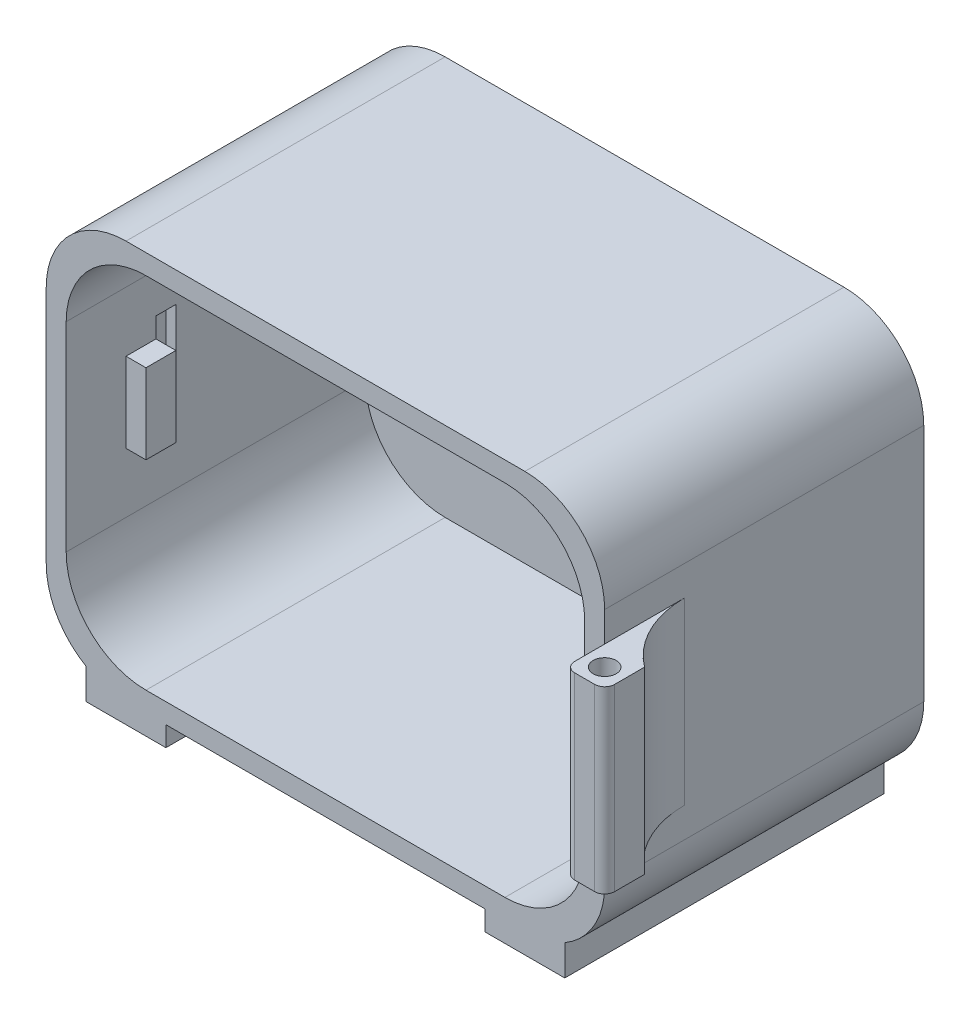
from build123d import *

# Parameters (mm, degrees)
BOSS_EXTRUDE1_DEPTH             = 95.25
BOSS_EXTRUDE2_DEPTH             = 6.35
SKETCH4_W                       = 25.4
SKETCH4_H                       = 101.6
BOSS_EXTRUDE3_DEPTH             = 6.35
BOSS_EXTRUDE3_DIRECTION_2_REACH = 187.35
BOSS_EXTRUDE5_DEPTH             = 28.575
BOSS_EXTRUDE5_DEPTH_BACK        = 28.575
SKETCH5_R                       = 3.675
FILLET1_R                       = 3.175
SKETCH8_W                       = 6.35
SKETCH8_H                       = 38.1
CUT_EXTRUDE1_DEPTH              = 3.175
SKETCH10_W                      = 9.525
SKETCH10_H                      = 25.4
BOSS_EXTRUDE6_DEPTH             = 6.35
SKETCH11_R                      = 44.824096384
CUT_EXTRUDE4_DEPTH              = 1.5875
SKETCH12_W                      = 1.13974359
SKETCH12_H                      = 13.025641026
SKETCH12_W_2                    = 4.884615385
SKETCH12_H_2                    = 1.302564103
CUT_EXTRUDE5_DEPTH              = 1.5875
FILLET2_R                       = 3.175


with BuildPart() as part:
    # Sketch1 → Boss-Extrude1 (new body)
    with BuildSketch(Plane.XY):
        with BuildLine():
            Line((-63.5, 63.5), (63.5, 63.5))
            ThreePointArc((63.5, 63.5), (81.460512242, 56.060512242), (88.9, 38.1))
            Line((88.9, 38.1), (88.9, -38.1))
            ThreePointArc((88.9, -38.1), (81.460512242, -56.060512242), (63.5, -63.5))
            Line((63.5, -63.5), (-63.5, -63.5))
            ThreePointArc((-63.5, -63.5), (-81.460512242, -56.060512242), (-88.9, -38.1))
            Line((-88.9, -38.1), (-88.9, 38.1))
            ThreePointArc((-88.9, 38.1), (-81.460512242, 56.060512242), (-63.5, 63.5))
        make_face()
        with BuildLine():
            Line((-82.55, 31.75), (-82.55, -31.75))
            ThreePointArc((-82.55, -31.75), (-75.110512242, -49.710512242), (-57.15, -57.15))
            Line((-57.15, -57.15), (57.15, -57.15))
            ThreePointArc((57.15, -57.15), (75.110512242, -49.710512242), (82.55, -31.75))
            Line((82.55, -31.75), (82.55, 31.75))
            ThreePointArc((82.55, 31.75), (75.110512242, 49.710512242), (57.15, 57.15))
            Line((57.15, 57.15), (-57.15, 57.15))
            ThreePointArc((-57.15, 57.15), (-75.110512242, 49.710512242), (-82.55, 31.75))
        make_face(mode=Mode.SUBTRACT)
    extrude(amount=-BOSS_EXTRUDE1_DEPTH)

    # Sketch2 → Boss-Extrude2 (add)
    with BuildSketch(Plane(origin=(0, 0, -95.25), x_dir=(-1, 0, 0), z_dir=(0, 0, -1))):
        with BuildLine():
            Line((-63.5, 63.5), (63.5, 63.5))
            ThreePointArc((63.5, 63.5), (81.460512242, 56.060512242), (88.9, 38.1))
            Line((88.9, 38.1), (88.9, -38.1))
            ThreePointArc((88.9, -38.1), (81.460512242, -56.060512242), (63.5, -63.5))
            Line((63.5, -63.5), (-63.5, -63.5))
            ThreePointArc((-63.5, -63.5), (-81.460512242, -56.060512242), (-88.9, -38.1))
            Line((-88.9, -38.1), (-88.9, 38.1))
            ThreePointArc((-88.9, 38.1), (-81.460512242, 56.060512242), (-63.5, 63.5))
        make_face()
    extrude(amount=BOSS_EXTRUDE2_DEPTH)

    # Sketch4 → Boss-Extrude3 (add)
    with BuildSketch(Plane.XZ.offset(63.5)):
        with Locations((-63.5, -50.8)):
            Rectangle(SKETCH4_W, SKETCH4_H)
        with Locations((63.5, -50.8)):
            Rectangle(SKETCH4_W, SKETCH4_H)
    extrude(amount=BOSS_EXTRUDE3_DEPTH)

    # Sketch4 → Boss-Extrude3 direction 2 (add, up to next)
    with BuildSketch(Plane.XZ.offset(63.5), mode=Mode.PRIVATE) as boss_extrude3_direction_2_sk1:
        with Locations((-63.5, -50.8)):
            Rectangle(SKETCH4_W, SKETCH4_H)
    boss_extrude3_direction_2_tool1 = extrude(boss_extrude3_direction_2_sk1.sketch, amount=-BOSS_EXTRUDE3_DIRECTION_2_REACH, mode=Mode.PRIVATE) - part.part
    # Sketch4 → Boss-Extrude3 direction 2 (add, up to next)
    with BuildSketch(Plane.XZ.offset(63.5), mode=Mode.PRIVATE) as boss_extrude3_direction_2_sk2:
        with Locations((63.5, -50.8)):
            Rectangle(SKETCH4_W, SKETCH4_H)
    boss_extrude3_direction_2_tool2 = extrude(boss_extrude3_direction_2_sk2.sketch, amount=-BOSS_EXTRUDE3_DIRECTION_2_REACH, mode=Mode.PRIVATE) - part.part
    add(boss_extrude3_direction_2_tool1.solids().sort_by_distance((-63.5, -63.5, -50.8))[0])
    add(boss_extrude3_direction_2_tool2.solids().sort_by_distance((63.5, -63.5, -50.8))[0])

    # Sketch5 → Boss-Extrude5 (add, two sides: drawn at the far end of the back side and taken through both)
    with BuildSketch(Plane(origin=(0, 0, 0), x_dir=(1, 0, 0), z_dir=(0, 1, 0)).offset(-BOSS_EXTRUDE5_DEPTH_BACK)):
        with BuildLine():
            ThreePointArc((101.6, 0), (92.251936686, 11.200968343), (88.9, 25.4))
            Line((88.9, 25.4), (88.9, 0))
            Line((88.9, 0), (88.9, -12.7))
            Line((88.9, -12.7), (101.6, -12.7))
            Line((101.6, -12.7), (101.6, 0))
        make_face()
        with Locations((95.25, -6.35)):
            Circle(SKETCH5_R, mode=Mode.SUBTRACT)
    extrude(amount=BOSS_EXTRUDE5_DEPTH + BOSS_EXTRUDE5_DEPTH_BACK)

    # Fillet1
    fillet1_edges = [part.edges().sort_by_distance(p)[0] for p in [
        (101.6, 0, 12.7),
    ]]
    fillet(fillet1_edges, radius=FILLET1_R)

    # Sketch8 → Cut-Extrude1 (cut)
    with BuildSketch(Plane(origin=(-82.55, 0, 0), x_dir=(0, 0, -1), z_dir=(1, 0, 0))):
        with Locations((31.75, 0)):
            Rectangle(SKETCH8_W, SKETCH8_H)
    extrude(amount=-CUT_EXTRUDE1_DEPTH, mode=Mode.SUBTRACT)

    # Sketch10 → Boss-Extrude6 (add)
    with BuildSketch(Plane(origin=(-82.55, 0, 0), x_dir=(0, 0, -1), z_dir=(1, 0, 0))):
        with Locations((23.8125, 0)):
            Rectangle(SKETCH10_W, SKETCH10_H)
    extrude(amount=BOSS_EXTRUDE6_DEPTH)

    # Sketch11 → Cut-Extrude4 (cut)
    # profile 1 of 2: a face of its own
    with BuildSketch(Plane(origin=(0, 0, -101.6), x_dir=(-1, 0, 0), z_dir=(0, 0, -1))):
        with Locations((0, 3.175)):
            Circle(SKETCH11_R)
        with BuildLine():
            Line((-8.558023622, 38.277554278), (9.414722671, 38.277554278))
            Line((9.414722671, 38.277554278), (12.376141094, 30.516595652))
            Line((12.376141094, 30.516595652), (6.555422124, 30.516595652))
            ThreePointArc((6.555422124, 30.516595652), (-1.070912861, 28.84594719), (6.555422124, 27.175298727))
            Line((6.555422124, 27.175298727), (13.309498487, 27.175298727))
            Line((13.309498487, 27.175298727), (31.249567059, -24.733260338))
            Line((31.249567059, -24.733260338), (24.338229167, -24.733260338))
            Line((24.338229167, -24.733260338), (24.338229167, -18.851270642))
            ThreePointArc((24.338229167, -18.851270642), (22.794206871, -11.23122082), (21.250184576, -18.851270642))
            Line((21.250184576, -18.851270642), (21.250184576, -24.733260338))
            Line((21.250184576, -24.733260338), (16.103443592, -24.733260338))
            Line((16.103443592, -24.733260338), (16.103443592, -18.851270642))
            ThreePointArc((16.103443592, -18.851270642), (14.239792343, -11.126064356), (12.376141094, -18.851270642))
            Line((12.376141094, -18.851270642), (12.376141094, -24.733260338))
            Line((12.376141094, -24.733260338), (10.515553381, -24.733260338))
            Line((10.515553381, -24.733260338), (8.456856988, -17.527822961))
            Line((8.456856988, -17.527822961), (-7.424515191, -17.527822961))
            Line((-7.424515191, -17.527822961), (-9.630261327, -24.733260338))
            Line((-9.630261327, -24.733260338), (-30.070175519, -24.733260338))
            Line((-30.070175519, -24.733260338), (-27.864429383, -17.527822961))
            Line((-27.864429383, -17.527822961), (-20.953091491, -17.527822961))
            ThreePointArc((-20.953091491, -17.527822961), (-12.798886715, -15.836750923), (-20.953091491, -14.145678885))
            Line((-20.953091491, -14.145678885), (-26.540981702, -14.145678885))
            Line((-26.540981702, -14.145678885), (-8.558023622, 38.277554278))
        make_face(mode=Mode.SUBTRACT)
    # profile 2 of 2: a face of its own
    with BuildSketch(Plane(origin=(0, 0, -101.6), x_dir=(-1, 0, 0), z_dir=(0, 0, -1))):
        Polygon((0.754840192, 15.029545848), (-4.852280703, -6.689071297), (6.018431459, -6.689071297), align=None)
    extrude(amount=-CUT_EXTRUDE4_DEPTH, mode=Mode.SUBTRACT)

    # Sketch12 → Cut-Extrude5 (cut)
    # profile 1 of 11: a face of its own
    with BuildSketch(Plane(origin=(0, 0, -101.6), x_dir=(-1, 0, 0), z_dir=(0, 0, -1))):
        with BuildLine():
            Line((51.288461538, -47.869230769), (52.428205128, -47.869230769))
            Line((52.428205128, -47.869230769), (52.428205128, -55.234314904))
            add(Edge.make_bspline(
                [(52.428205128, -55.234314904), (52.427199859, -55.391205604), (52.425259449, -55.694042448), (52.411285924, -56.131932206), (52.381819467, -56.536394859), (52.348405109, -56.909275054), (52.300338453, -57.248844425), (52.241641349, -57.556116225), (52.175471884, -57.831385323), (52.117341381, -58.000929746), (52.08984375, -58.081129808)],
                knots=[0, 0, 0, 0, 1.307562039, 2.523909702, 3.650326591, 4.686913197, 5.643429486, 6.506965704, 7.293745905, 8, 8, 8, 8], degree=3))
            add(Edge.make_bspline(
                [(52.08984375, -58.081129808), (52.049242798, -58.18537838), (51.969254836, -58.39075856), (51.819446966, -58.681894524), (51.651683945, -58.956019996), (51.460070878, -59.211607319), (51.245474246, -59.44737343), (51.012949975, -59.668440513), (50.757969566, -59.870131635), (50.48067881, -60.048966857), (50.187469798, -60.210028454), (49.878511085, -60.349534569), (49.555544866, -60.471043973), (49.215537231, -60.562058689), (48.863818951, -60.640924675), (48.496253987, -60.692249677), (48.114989839, -60.727182146), (47.855745174, -60.730412419), (47.72421875, -60.732051282)],
                knots=[0, 0, 0, 0, 0.981931301, 1.934503488, 2.87077864, 3.801706999, 4.735015492, 5.667491629, 6.616593066, 7.585388521, 8.561939025, 9.551802639, 10.560317337, 11.588439944, 12.640189604, 13.723962949, 14.845264515, 16, 16, 16, 16], degree=3))
            add(Edge.make_bspline(
                [(47.72421875, -60.732051282), (47.532322713, -60.728943462), (47.157498196, -60.722873055), (46.611017223, -60.652148877), (46.092005525, -60.552165866), (45.607321067, -60.400834743), (45.160026716, -60.21564338), (44.753177225, -60.003027408), (44.39042492, -59.759226202), (44.063404735, -59.481638307), (43.768250965, -59.151570091), (43.490566228, -58.762591428), (43.223282238, -58.308777287), (43.066641753, -57.975700871), (42.984615385, -57.801282051)],
                knots=[0, 0, 0, 0, 1.157897085, 2.2616841, 3.32207898, 4.345638746, 5.321241055, 6.241986252, 7.112515963, 7.955008012, 8.825025602, 9.77857164, 10.836726669, 12, 12, 12, 12], degree=3))
            Line((42.984615385, -57.801282051), (44.124358974, -57.801282051))
            add(Edge.make_bspline(
                [(44.124358974, -57.801282051), (44.216024705, -57.946809086), (44.395219921, -58.231296519), (44.730312981, -58.599644257), (45.097547365, -58.914435037), (45.509316501, -59.168111274), (45.967333711, -59.359372517), (46.471874544, -59.495717165), (47.0270446, -59.577346476), (47.413553549, -59.5871846), (47.614823718, -59.592307692)],
                knots=[0, 0, 0, 0, 0.997731894, 1.950442991, 2.880492273, 3.800895997, 4.748200782, 5.754801363, 6.83083817, 8, 8, 8, 8], degree=3))
            add(Edge.make_bspline(
                [(47.614823718, -59.592307692), (47.813549291, -59.587118295), (48.196672306, -59.577113657), (48.747602548, -59.495680734), (49.25050418, -59.359342846), (49.702479765, -59.168449559), (50.098196411, -58.934586655), (50.439325637, -58.673329242), (50.715622033, -58.378758174), (50.90145194, -58.107407049), (51.016966124, -57.865656635), (51.090525383, -57.657548644), (51.150302358, -57.422225345), (51.200303483, -57.160475674), (51.241563654, -56.871925661), (51.267699828, -56.55591554), (51.286589487, -56.213163505), (51.287823092, -55.975516975), (51.288461538, -55.852524038)],
                knots=[0, 0, 0, 0, 1.570740765, 3.028230971, 4.391408896, 5.680370741, 6.894727393, 8.017376726, 9.065722033, 10.075533815, 10.603371122, 11.180248986, 11.817768598, 12.521299649, 13.286540596, 14.121245857, 15.027658897, 16, 16, 16, 16], degree=3))
            Line((51.288461538, -55.852524038), (51.288461538, -55.371694712))
            add(Edge.make_bspline(
                [(51.288461538, -55.371694712), (51.172778627, -55.509369251), (50.94344763, -55.782296676), (50.547398758, -56.139934615), (50.114811664, -56.447950002), (49.64642281, -56.70056619), (49.153705474, -56.902610217), (48.641996238, -57.043917532), (48.115882209, -57.135212026), (47.759367265, -57.145035716), (47.579206731, -57.15)],
                knots=[0, 0, 0, 0, 1.012485704, 2.007162095, 2.997754123, 3.998611389, 4.999708251, 5.992315798, 6.98544096, 8, 8, 8, 8], degree=3))
            add(Edge.make_bspline(
                [(47.579206731, -57.15), (47.473120839, -57.14813119), (47.262204473, -57.144415684), (46.948860104, -57.111908121), (46.640139657, -57.064741256), (46.336763132, -56.995502891), (46.038292765, -56.906632912), (45.745221788, -56.795537889), (45.455177277, -56.66993446), (45.173431413, -56.52198743), (44.90279031, -56.357387059), (44.645295324, -56.179083085), (44.402295197, -55.988008724), (44.176102792, -55.782279829), (43.967014813, -55.562194153), (43.772219063, -55.330097832), (43.594936689, -55.082749942), (43.43152982, -54.824660696), (43.289806709, -54.554111058), (43.165403416, -54.276967683), (43.057237861, -53.993823162), (42.971003403, -53.703729535), (42.905140792, -53.406869688), (42.856117969, -53.103729945), (42.828312474, -52.793376824), (42.823976607, -52.584293643), (42.821794872, -52.479086538)],
                knots=[0, 0, 0, 0, 1.028754217, 2.045334182, 3.052854819, 4.056607503, 5.061168794, 6.071104265, 7.095078842, 8.125279047, 9.155117945, 10.165957491, 11.161587969, 12.151493252, 13.128948131, 14.104219989, 15.088194871, 16.07871515, 17.064853787, 18.047899887, 19.02414258, 20.002704429, 20.980574569, 21.971845993, 22.979467364, 24, 24, 24, 24], degree=3))
            add(Edge.make_bspline(
                [(42.821794872, -52.479086538), (42.823678704, -52.373846733), (42.827439071, -52.163774731), (42.859918339, -51.852155247), (42.906248626, -51.544708439), (42.97957396, -51.244603296), (43.06782997, -50.948422054), (43.177135505, -50.658352398), (43.30855786, -50.374305979), (43.457364666, -50.096072451), (43.624584088, -49.827385391), (43.807944804, -49.572200133), (44.007668176, -49.332394481), (44.220998841, -49.105549178), (44.450541606, -48.893852903), (44.696177721, -48.697819459), (44.955485887, -48.514162849), (45.229269765, -48.346844569), (45.513304861, -48.198863274), (45.800375, -48.063834708), (46.094282881, -47.956668046), (46.389548953, -47.862241372), (46.691373215, -47.79534795), (46.9960549, -47.743741529), (47.304637097, -47.71230097), (47.511294745, -47.708376362), (47.614823718, -47.706410256)],
                knots=[0, 0, 0, 0, 1.008818848, 2.013730394, 3.001654427, 3.987803273, 4.973046549, 5.963777569, 6.957074694, 7.972068341, 8.987420212, 9.989399531, 10.982630087, 11.977756091, 12.973280677, 13.973972381, 14.989194003, 16.018387222, 17.047741039, 18.059210846, 19.057554164, 20.045176975, 21.029480261, 22.018708529, 23.007435371, 24, 24, 24, 24], degree=3))
            add(Edge.make_bspline(
                [(47.614823718, -47.706410256), (47.785551411, -47.711333042), (48.122686145, -47.721054032), (48.618824354, -47.797330759), (49.097586196, -47.918938751), (49.561673282, -48.093166896), (50.014866073, -48.331019892), (50.455670936, -48.644321446), (50.885363223, -49.035881822), (51.150531351, -49.336156501), (51.288461538, -49.492347756)],
                knots=[0, 0, 0, 0, 0.96728863, 1.910097829, 2.838038873, 3.762875196, 4.71315279, 5.730631239, 6.819562287, 8, 8, 8, 8], degree=3))
            Line((51.288461538, -49.492347756), (51.288461538, -47.869230769))
        make_face()
        with BuildLine():
            add(Edge.make_bspline(
                [(47.706410256, -48.846153846), (47.539747417, -48.851818284), (47.209790334, -48.863032669), (46.726144062, -48.958771486), (46.259230618, -49.108798037), (45.817976636, -49.323401242), (45.404656551, -49.585000334), (45.037899346, -49.901920806), (44.717115793, -50.263857006), (44.44576056, -50.667536474), (44.229746744, -51.103045873), (44.076826336, -51.562099108), (43.97794768, -52.037278654), (43.9670342, -52.361573528), (43.961538462, -52.524879808)],
                knots=[0, 0, 0, 0, 1.026226791, 2.031711442, 3.026614839, 4.04107745, 5.047145931, 6.032893242, 7.017642609, 8.019221815, 9.021877557, 10.003543541, 10.994637589, 12, 12, 12, 12], degree=3))
            add(Edge.make_bspline(
                [(43.961538462, -52.524879808), (43.964171922, -52.648009111), (43.969351169, -52.890168444), (44.019148151, -53.24554309), (44.099633367, -53.584017371), (44.213705516, -53.905611758), (44.355048152, -54.212170871), (44.532820469, -54.501582952), (44.742011138, -54.774105742), (44.980982821, -55.027723588), (45.244331407, -55.258721959), (45.529969644, -55.461697135), (45.837510122, -55.627706894), (46.159389119, -55.771183647), (46.503416719, -55.875973408), (46.864637689, -55.955942692), (47.245607559, -56.001694469), (47.505310727, -56.007365193), (47.637720353, -56.01025641)],
                knots=[0, 0, 0, 0, 1.039728707, 2.044842319, 3.024901384, 3.974314358, 4.923051295, 5.871625912, 6.837440708, 7.820715446, 8.810779094, 9.792721783, 10.773906224, 11.758876063, 12.764959493, 13.806266761, 14.881525401, 16, 16, 16, 16], degree=3))
            add(Edge.make_bspline(
                [(47.637720353, -56.01025641), (47.771845989, -56.007471086), (48.034127251, -56.002024414), (48.417198935, -55.955203148), (48.780174878, -55.87964912), (49.122722262, -55.772377571), (49.446134443, -55.635501504), (49.74677833, -55.462285778), (50.031100299, -55.265020553), (50.290022128, -55.03492553), (50.524152671, -54.781342834), (50.728190025, -54.5054085), (50.902051026, -54.211274617), (51.046024285, -53.898974339), (51.155938083, -53.566080658), (51.229666681, -53.213425767), (51.281216871, -52.8426992), (51.286009941, -52.588667936), (51.288461538, -52.458733974)],
                knots=[0, 0, 0, 0, 1.121943988, 2.193949579, 3.223793937, 4.220241907, 5.192961521, 6.155822191, 7.11847367, 8.083710714, 9.04790392, 10.001595906, 10.949595423, 11.902125208, 12.873731292, 13.87582262, 14.913508608, 16, 16, 16, 16], degree=3))
            add(Edge.make_bspline(
                [(51.288461538, -52.458733974), (51.28360082, -52.289577761), (51.274104683, -51.959105963), (51.184489283, -51.477569977), (51.039998806, -51.024837932), (50.837354876, -50.602341676), (50.583420159, -50.214557882), (50.277564793, -49.868668503), (49.925063482, -49.564228252), (49.526929004, -49.310597664), (49.098585417, -49.105708802), (48.650379935, -48.951996086), (48.182977974, -48.864931), (47.866180431, -48.85244892), (47.706410256, -48.846153846)],
                knots=[0, 0, 0, 0, 1.070913519, 2.092188694, 3.091357305, 4.074328408, 5.051968682, 6.018948707, 6.99050112, 7.9935919, 9.000589572, 9.992915277, 10.987769056, 12, 12, 12, 12], degree=3))
        make_face(mode=Mode.SUBTRACT)
    # profile 2 of 11: a face of its own
    with BuildSketch(Plane(origin=(0, 0, -101.6), x_dir=(-1, 0, 0), z_dir=(0, 0, -1))):
        with BuildLine():
            Line((37.611538462, -47.869230769), (38.751282051, -47.869230769))
            Line((38.751282051, -47.869230769), (38.751282051, -49.235396635))
            add(Edge.make_bspline(
                [(38.751282051, -49.235396635), (38.835424119, -49.108194058), (38.996345169, -48.864920117), (39.263817798, -48.543177225), (39.537787029, -48.276785485), (39.819564423, -48.064501288), (40.1112221, -47.905522257), (40.406359039, -47.789070387), (40.709618601, -47.720209843), (40.913406155, -47.71101628), (41.015504808, -47.706410256)],
                knots=[0, 0, 0, 0, 1.2804753, 2.448899062, 3.506932113, 4.484331642, 5.4025378, 6.288909075, 7.142734305, 8, 8, 8, 8], degree=3))
            add(Edge.make_bspline(
                [(41.015504808, -47.706410256), (41.094703192, -47.710730167), (41.257659016, -47.719618664), (41.504338699, -47.782069371), (41.758496367, -47.881775338), (41.922298744, -47.975538432), (42.007692308, -48.024419071)],
                knots=[0, 0, 0, 0, 0.901110191, 1.854092781, 2.881294221, 4, 4, 4, 4], degree=3))
            Line((42.007692308, -48.024419071), (41.381850962, -49.011518429))
            add(Edge.make_bspline(
                [(41.381850962, -49.011518429), (41.327026799, -48.987060892), (41.222960044, -48.940635805), (41.070724903, -48.88569194), (40.93036691, -48.853339902), (40.840945998, -48.848438728), (40.799258814, -48.846153846)],
                knots=[0, 0, 0, 0, 1.180555205, 2.24091978, 3.179933427, 4, 4, 4, 4], degree=3))
            add(Edge.make_bspline(
                [(40.799258814, -48.846153846), (40.70779801, -48.852249982), (40.52124448, -48.864684331), (40.247343582, -48.962433719), (39.981560865, -49.120368162), (39.770480833, -49.295523339), (39.607041802, -49.464425347), (39.490418698, -49.61192098), (39.383438444, -49.7773063), (39.281220787, -49.957754009), (39.188088806, -50.156345165), (39.101167577, -50.371095682), (39.022576846, -50.602254292), (38.977763103, -50.763299437), (38.954807692, -50.845793269)],
                knots=[0, 0, 0, 0, 1.125678352, 2.296057538, 3.5422874, 4.923748041, 5.663163013, 6.437101912, 7.23742474, 8.08941207, 8.991984279, 9.93940061, 10.944477711, 12, 12, 12, 12], degree=3))
            add(Edge.make_bspline(
                [(38.954807692, -50.845793269), (38.937635865, -50.919370442), (38.899601572, -51.082338288), (38.862620849, -51.355745792), (38.826082884, -51.678774497), (38.800332297, -52.052323563), (38.776463402, -52.475460145), (38.763001103, -52.948828862), (38.751741136, -53.472915593), (38.751439722, -53.839308246), (38.751282051, -54.030969551)],
                knots=[0, 0, 0, 0, 0.566838948, 1.255505196, 2.06880316, 3.007127437, 4.065329342, 5.249902469, 6.561414163, 8, 8, 8, 8], degree=3))
            Line((38.751282051, -54.030969551), (38.751282051, -57.15))
            Line((38.751282051, -57.15), (37.611538462, -57.15))
            Line((37.611538462, -57.15), (37.611538462, -47.869230769))
        make_face()
    # profile 3 of 11: a face of its own
    with BuildSketch(Plane(origin=(0, 0, -101.6), x_dir=(-1, 0, 0), z_dir=(0, 0, -1))):
        with BuildLine():
            add(Edge.make_bspline(
                [(30.859575321, -47.706410256), (31.033715082, -47.710118261), (31.375160597, -47.717388753), (31.875206354, -47.795094486), (32.352527276, -47.913920636), (32.808951459, -48.078191733), (33.238633445, -48.298380525), (33.647831959, -48.56112281), (34.035425106, -48.872391078), (34.267737241, -49.113176069), (34.385657051, -49.235396635)],
                knots=[0, 0, 0, 0, 1.054011418, 2.066658804, 3.057071809, 4.030435133, 4.997543892, 5.974964718, 6.972108034, 8, 8, 8, 8], degree=3))
            add(Edge.make_bspline(
                [(34.385657051, -49.235396635), (34.48719157, -49.352287383), (34.688295636, -49.583806722), (34.946162673, -49.959202803), (35.168309477, -50.347968311), (35.346337935, -50.755265754), (35.486709307, -51.17753956), (35.586370547, -51.616241144), (35.645650283, -52.070401661), (35.653643906, -52.378844159), (35.657692308, -52.53505609)],
                knots=[0, 0, 0, 0, 1.025258237, 2.030674902, 3.01204498, 3.988269485, 4.97094183, 5.956517959, 6.965070386, 8, 8, 8, 8], degree=3))
            add(Edge.make_bspline(
                [(35.657692308, -52.53505609), (35.654131455, -52.692173442), (35.647095044, -53.002644657), (35.580533922, -53.459914927), (35.477006839, -53.90330757), (35.328845598, -54.330966258), (35.138860458, -54.744198232), (34.907028535, -55.141198597), (34.631722953, -55.522750623), (34.319651307, -55.885614436), (33.974748785, -56.22004613), (33.600584476, -56.511522994), (33.204511268, -56.761246811), (32.781262529, -56.962401804), (32.334703362, -57.121005574), (31.863870572, -57.232402777), (31.369495603, -57.299755172), (31.031939685, -57.308404138), (30.859575321, -57.312820513)],
                knots=[0, 0, 0, 0, 0.998656419, 1.973391657, 2.932242238, 3.890759089, 4.846373663, 5.82037756, 6.809684879, 7.83454468, 8.860553229, 9.859544525, 10.845671541, 11.83227036, 12.833544569, 13.85385346, 14.904124723, 16, 16, 16, 16], degree=3))
            add(Edge.make_bspline(
                [(30.859575321, -57.312820513), (30.686366481, -57.308389315), (30.347128219, -57.299710591), (29.851008227, -57.23266445), (29.37933161, -57.121056914), (28.932187838, -56.961880583), (28.507119393, -56.761240381), (28.108751247, -56.512277965), (27.734282983, -56.219959687), (27.389307496, -55.885637858), (27.077255414, -55.522744588), (26.801944784, -55.141200163), (26.570114172, -54.744197824), (26.380128689, -54.330966367), (26.231967539, -53.90330754), (26.128440432, -53.459914935), (26.061879316, -53.002644655), (26.054842904, -52.692173441), (26.051282051, -52.53505609)],
                knots=[0, 0, 0, 0, 1.099876186, 2.154163076, 3.173186993, 4.173200201, 5.163417411, 6.152872554, 7.150605724, 8.17532212, 9.198891216, 10.186952605, 11.159729845, 12.11414092, 13.071450619, 14.029093627, 15.002601286, 16, 16, 16, 16], degree=3))
            add(Edge.make_bspline(
                [(26.051282051, -52.53505609), (26.055358063, -52.379693195), (26.063427866, -52.072101363), (26.122647999, -51.6187946), (26.221920475, -51.180835503), (26.362460114, -50.760191633), (26.542129521, -50.35467905), (26.761154766, -49.964952949), (27.021652204, -49.591254359), (27.221956428, -49.36003424), (27.323317308, -49.243028846)],
                knots=[0, 0, 0, 0, 1.031353054, 2.041901799, 3.029428768, 4.008703097, 4.981709435, 5.96992636, 6.972712378, 8, 8, 8, 8], degree=3))
            add(Edge.make_bspline(
                [(27.323317308, -49.243028846), (27.441059338, -49.119748352), (27.672619758, -48.877295569), (28.062142285, -48.566934696), (28.47033415, -48.298724942), (28.904764596, -48.082911246), (29.360813823, -47.912954339), (29.840580789, -47.794788041), (30.342323374, -47.717668724), (30.685439713, -47.710200479), (30.859575321, -47.706410256)],
                knots=[0, 0, 0, 0, 1.027980169, 2.021703884, 2.998553061, 3.971491411, 4.943284454, 5.930300938, 6.949603206, 8, 8, 8, 8], degree=3))
        make_face()
        with BuildLine():
            add(Edge.make_bspline(
                [(30.854487179, -48.846153846), (30.731342133, -48.849653936), (30.488231009, -48.856563761), (30.130382801, -48.909119644), (29.785885671, -48.992386302), (29.454086037, -49.110692449), (29.136102811, -49.26345131), (28.831631551, -49.451078789), (28.539776698, -49.671089802), (28.266247496, -49.923140068), (28.015214535, -50.19847242), (27.795765877, -50.491836465), (27.609166206, -50.798473778), (27.453717629, -51.11870323), (27.337940118, -51.455769989), (27.25385515, -51.805856851), (27.201348849, -52.169677077), (27.19450399, -52.4170042), (27.191025641, -52.542688301)],
                knots=[0, 0, 0, 0, 1.021534396, 2.016698045, 2.994645724, 3.958388632, 4.93408049, 5.916473867, 6.921342795, 7.962252576, 8.998418191, 10.008913653, 10.997312074, 11.973003931, 12.956656626, 13.948281152, 14.957379055, 16, 16, 16, 16], degree=3))
            add(Edge.make_bspline(
                [(27.191025641, -52.542688301), (27.196856115, -52.705074228), (27.208428517, -53.027379928), (27.302536375, -53.502037431), (27.45996659, -53.957720151), (27.672554719, -54.391756752), (27.938914427, -54.793339018), (28.252738926, -55.151375547), (28.610660125, -55.460478348), (29.008411425, -55.716948845), (29.437868522, -55.92072853), (29.89237003, -56.065141956), (30.36640912, -56.15901924), (30.69037063, -56.168350018), (30.854487179, -56.173076923)],
                knots=[0, 0, 0, 0, 1.016792936, 2.018143844, 3.017858371, 4.030088057, 5.03801393, 6.028138512, 7.003788237, 7.991172063, 8.984598303, 9.972568034, 10.972917682, 12, 12, 12, 12], degree=3))
            add(Edge.make_bspline(
                [(30.854487179, -56.173076923), (31.01859429, -56.168322478), (31.342537166, -56.158937334), (31.815917608, -56.06561476), (32.269176877, -55.920095762), (32.698187912, -55.717178029), (33.095758159, -55.45950441), (33.456253542, -55.153120985), (33.767398502, -54.792390724), (34.033494726, -54.391224834), (34.249564335, -53.958393042), (34.406257667, -53.501953328), (34.500591765, -53.027401347), (34.512133629, -52.705081404), (34.517948718, -52.542688301)],
                knots=[0, 0, 0, 0, 1.02726834, 2.027799167, 3.010890988, 4.004497153, 4.992059811, 5.971914811, 6.958719428, 7.966827853, 8.981595046, 9.981490638, 10.983022906, 12, 12, 12, 12], degree=3))
            add(Edge.make_bspline(
                [(34.517948718, -52.542688301), (34.514471567, -52.417003449), (34.507629064, -52.169674847), (34.455105622, -51.805865373), (34.371084092, -51.455738722), (34.255072795, -51.118818596), (34.100299659, -50.797644652), (33.910101582, -50.492736785), (33.691549004, -50.197456175), (33.437486879, -49.924030107), (33.164243194, -49.670991546), (32.872270055, -49.450993476), (32.568250276, -49.264275915), (32.251190847, -49.109385842), (31.919348673, -48.993462636), (31.575334233, -48.908638858), (31.219012837, -48.856785859), (30.97677288, -48.849720517), (30.854487179, -48.846153846)],
                knots=[0, 0, 0, 0, 1.042956736, 2.052379634, 3.044323526, 4.02829302, 5.004299113, 5.996692471, 7.007513377, 8.048758398, 9.090003419, 10.095195979, 11.07790575, 12.047570684, 13.018257071, 13.989683339, 14.985167495, 16, 16, 16, 16], degree=3))
        make_face(mode=Mode.SUBTRACT)
    # profile 4 of 11: a face of its own
    with BuildSketch(Plane(origin=(0, 0, -101.6), x_dir=(-1, 0, 0), z_dir=(0, 0, -1))):
        with BuildLine():
            add(Edge.make_bspline(
                [(22.876282051, -55.196153846), (22.947003678, -55.200356337), (23.08564516, -55.208594828), (23.286084283, -55.265115901), (23.467493477, -55.365477327), (23.629081908, -55.499236551), (23.76227398, -55.661417957), (23.866212057, -55.841380255), (23.922240775, -56.043497462), (23.930419255, -56.182942283), (23.934615385, -56.254487179)],
                knots=[0, 0, 0, 0, 1.020151414, 1.999887582, 2.974338812, 3.990962822, 5.007586832, 5.987933904, 6.967670073, 8, 8, 8, 8], degree=3))
            add(Edge.make_bspline(
                [(23.934615385, -56.254487179), (23.930277062, -56.324312976), (23.921721953, -56.462008421), (23.866340489, -56.662601157), (23.76148185, -56.842675925), (23.63000059, -57.007057969), (23.467453531, -57.141100557), (23.285655403, -57.240608122), (23.086115694, -57.301176163), (22.947082178, -57.308891584), (22.876282051, -57.312820513)],
                knots=[0, 0, 0, 0, 1.009421747, 1.99056486, 2.972319754, 3.999869655, 5.017953583, 5.993804169, 6.978383603, 8, 8, 8, 8], degree=3))
            add(Edge.make_bspline(
                [(22.876282051, -57.312820513), (22.805430908, -57.309033746), (22.667110917, -57.301640985), (22.468316023, -57.239364517), (22.285410737, -57.142033675), (22.122895326, -57.006808032), (21.990312872, -56.843521797), (21.890072197, -56.661360993), (21.829873657, -56.462582635), (21.821956576, -56.324426073), (21.817948718, -56.254487179)],
                knots=[0, 0, 0, 0, 1.022052826, 1.995314843, 2.982371812, 4.00089066, 5.028879526, 6.005146991, 6.990147033, 8, 8, 8, 8], degree=3))
            add(Edge.make_bspline(
                [(21.817948718, -56.254487179), (21.821802621, -56.182825145), (21.829326894, -56.042913817), (21.890198575, -55.842619912), (21.989535115, -55.660580147), (22.123811834, -55.499483985), (22.285371422, -55.364547201), (22.467874795, -55.266340666), (22.667589699, -55.208136885), (22.805511475, -55.200217467), (22.876282051, -55.196153846)],
                knots=[0, 0, 0, 0, 1.032775665, 2.016367738, 2.991239715, 4.008302682, 5.025365648, 6.011011707, 6.979408107, 8, 8, 8, 8], degree=3))
        make_face()
    # profile 5 of 11: a face of its own
    with BuildSketch(Plane(origin=(0, 0, -101.6), x_dir=(-1, 0, 0), z_dir=(0, 0, -1))):
        with BuildLine():
            Line((9.606410256, -57.15), (9.606410256, -44.124358974))
            Line((9.606410256, -44.124358974), (10.746153846, -44.124358974))
            Line((10.746153846, -44.124358974), (10.746153846, -49.553405449))
            add(Edge.make_bspline(
                [(10.746153846, -49.553405449), (10.874581395, -49.405512382), (11.125148837, -49.116966911), (11.54525196, -48.740148296), (11.985780741, -48.420643593), (12.450086412, -48.157259677), (12.938829341, -47.956695446), (13.44948585, -47.810019917), (13.98336134, -47.721530297), (14.347376629, -47.711493403), (14.531730769, -47.706410256)],
                knots=[0, 0, 0, 0, 1.077089805, 2.101446609, 3.097517232, 4.067117542, 5.031729543, 5.997785507, 6.985986182, 8, 8, 8, 8], degree=3))
            add(Edge.make_bspline(
                [(14.531730769, -47.706410256), (14.695619326, -47.710910513), (15.019654935, -47.719808287), (15.496021583, -47.787424885), (15.954358324, -47.897072337), (16.394415675, -48.049081102), (16.81414027, -48.250767906), (17.217125991, -48.492217794), (17.601308192, -48.779739731), (17.96073592, -49.108482173), (18.292002307, -49.465376204), (18.581970558, -49.847030491), (18.826898027, -50.247897247), (19.02948586, -50.666634617), (19.186135109, -51.104952805), (19.29405705, -51.56242204), (19.362613335, -52.038592279), (19.371250228, -52.362670166), (19.375641026, -52.527423878)],
                knots=[0, 0, 0, 0, 1.034377878, 2.045141349, 3.03070803, 4.00595497, 4.978199603, 5.965204761, 6.967410914, 8.002051993, 9.036360596, 10.037508045, 11.022711142, 11.997267194, 12.969246472, 13.954813154, 14.960274251, 16, 16, 16, 16], degree=3))
            add(Edge.make_bspline(
                [(19.375641026, -52.527423878), (19.371154513, -52.689621085), (19.362307816, -53.009448434), (19.29473907, -53.480097938), (19.183174052, -53.933084075), (19.023657758, -54.367236323), (18.823124981, -54.784594294), (18.572349781, -55.180400332), (18.282749868, -55.561541758), (17.947719701, -55.915776078), (17.585176237, -56.243194415), (17.19723027, -56.527695697), (16.793653583, -56.773412104), (16.368156005, -56.968104728), (15.927037683, -57.125588072), (15.465572708, -57.234872264), (14.986371852, -57.298637349), (14.660820457, -57.30805555), (14.496113782, -57.312820513)],
                knots=[0, 0, 0, 0, 1.024244038, 2.01964794, 2.996620209, 3.965911562, 4.936179293, 5.91563013, 6.920572822, 7.955171681, 8.990768464, 10.002129126, 10.989675881, 11.969873457, 12.952483066, 13.943799762, 14.959703725, 16, 16, 16, 16], degree=3))
            add(Edge.make_bspline(
                [(14.496113782, -57.312820513), (14.30755466, -57.307593163), (13.9378231, -57.297343241), (13.396974858, -57.212365802), (12.885050378, -57.067725103), (12.396218131, -56.873372446), (11.937466108, -56.610197044), (11.505881709, -56.28378255), (11.104186614, -55.888750369), (10.867542741, -55.58735582), (10.746153846, -55.432752404)],
                knots=[0, 0, 0, 0, 1.035807596, 2.031038093, 2.998900396, 3.954262848, 4.914341711, 5.895762244, 6.92060972, 8, 8, 8, 8], degree=3))
            Line((10.746153846, -55.432752404), (10.746153846, -57.15))
            Line((10.746153846, -57.15), (9.606410256, -57.15))
        make_face()
        with BuildLine():
            add(Edge.make_bspline(
                [(14.4859375, -56.173076923), (14.652541008, -56.167149184), (14.981389832, -56.15544877), (15.464148729, -56.06410448), (15.926117432, -55.912124982), (16.364968045, -55.704266954), (16.773832977, -55.442929856), (17.139058249, -55.126713752), (17.463741766, -54.765665399), (17.734621068, -54.358417426), (17.960776298, -53.924981052), (18.116127329, -53.469035444), (18.220338889, -53.002782924), (18.230688657, -52.686567277), (18.235897436, -52.527423878)],
                knots=[0, 0, 0, 0, 1.031910345, 2.036826888, 3.032245421, 4.038315463, 5.03827337, 6.029480047, 7.023177075, 8.037597977, 9.052889626, 10.043399556, 11.015292101, 12, 12, 12, 12], degree=3))
            add(Edge.make_bspline(
                [(18.235897436, -52.527423878), (18.229047622, -52.368436055), (18.215375342, -52.051095128), (18.119672559, -51.58065205), (17.952548578, -51.124948383), (17.730777466, -50.685245396), (17.455485062, -50.275188521), (17.132520565, -49.906924345), (16.762835155, -49.589206688), (16.353447319, -49.324357001), (15.917364913, -49.108240909), (15.458384613, -48.960031816), (14.986096568, -48.863010394), (14.665347208, -48.851801271), (14.503745994, -48.846153846)],
                knots=[0, 0, 0, 0, 0.984795267, 1.965658976, 2.959410029, 3.983795688, 5.009594896, 6.01088574, 7.009236619, 8.019050059, 9.024672985, 10.014834719, 10.999826153, 12, 12, 12, 12], degree=3))
            add(Edge.make_bspline(
                [(14.503745994, -48.846153846), (14.338763895, -48.85179808), (14.011307906, -48.863000738), (13.5280975, -48.960202271), (13.056153584, -49.109146461), (12.605167397, -49.322983071), (12.184782682, -49.584644657), (11.808816917, -49.892130523), (11.48467098, -50.243303333), (11.217812154, -50.637024385), (11.00588617, -51.062238657), (10.854270855, -51.515854366), (10.763557852, -51.9954837), (10.752025771, -52.32435276), (10.746153846, -52.491806891)],
                knots=[0, 0, 0, 0, 1.016820015, 2.018181405, 3.029022337, 4.06341356, 5.088169224, 6.076823655, 7.05054209, 8.02560866, 9.001194327, 9.972267242, 10.967515442, 12, 12, 12, 12], degree=3))
            add(Edge.make_bspline(
                [(10.746153846, -52.491806891), (10.749636079, -52.620032689), (10.756490215, -52.872421638), (10.808851838, -53.242999258), (10.892148096, -53.597630765), (11.009508775, -53.936702605), (11.16372754, -54.258289972), (11.349547648, -54.564890034), (11.57071505, -54.853736216), (11.820747532, -55.124120378), (12.096382456, -55.370171681), (12.392194915, -55.58345267), (12.702139979, -55.767109874), (13.029763587, -55.913504017), (13.371253127, -56.032980249), (13.730112822, -56.111842697), (14.102663419, -56.166180696), (14.356834314, -56.170753977), (14.4859375, -56.173076923)],
                knots=[0, 0, 0, 0, 1.050331198, 2.067384183, 3.060053655, 4.031335885, 5.001026174, 5.976994447, 6.963687968, 7.976578778, 8.990422448, 9.985569286, 10.960374351, 11.936812464, 12.921228065, 13.919088064, 14.943024695, 16, 16, 16, 16], degree=3))
        make_face(mode=Mode.SUBTRACT)
    # profile 6 of 11: a face of its own
    with BuildSketch(Plane(origin=(0, 0, -101.6), x_dir=(-1, 0, 0), z_dir=(0, 0, -1))):
        with BuildLine():
            Line((7.001282051, -47.869230769), (7.001282051, -57.15))
            Line((7.001282051, -57.15), (5.861538462, -57.15))
            Line((5.861538462, -57.15), (5.861538462, -55.544691506))
            add(Edge.make_bspline(
                [(5.861538462, -55.544691506), (5.73301885, -55.689978033), (5.482211212, -55.973506517), (5.063324869, -56.343918971), (4.619303195, -56.650091738), (4.152301258, -56.897378575), (3.662740775, -57.083132608), (3.151706973, -57.215162385), (2.618991391, -57.300048587), (2.255218561, -57.308525009), (2.070873397, -57.312820513)],
                knots=[0, 0, 0, 0, 1.074387032, 2.096679803, 3.090159297, 4.057316773, 5.018401886, 5.985159533, 6.978961417, 8, 8, 8, 8], degree=3))
            add(Edge.make_bspline(
                [(2.070873397, -57.312820513), (1.906978251, -57.308370533), (1.583769764, -57.299594977), (1.108321399, -57.231514618), (0.650786665, -57.122183505), (0.210733216, -56.970143135), (-0.208991426, -56.768464154), (-0.61198092, -56.527014482), (-0.996147545, -56.23948347), (-1.355635701, -55.910778339), (-1.686677531, -55.553745099), (-1.977185577, -55.172942687), (-2.219403896, -54.770017755), (-2.421951046, -54.35007174), (-2.577966353, -53.909871889), (-2.686727825, -53.450940451), (-2.754728875, -52.973820053), (-2.763500804, -52.648919497), (-2.767948718, -52.484174679)],
                knots=[0, 0, 0, 0, 1.033919861, 2.038935746, 3.024066025, 3.998881131, 4.97069526, 5.957263378, 6.95902576, 7.993208707, 9.027059324, 10.027763471, 11.009749337, 11.988697705, 12.965288445, 13.950418724, 14.960734635, 16, 16, 16, 16], degree=3))
            add(Edge.make_bspline(
                [(-2.767948718, -52.484174679), (-2.763402222, -52.322834955), (-2.754414044, -52.003875024), (-2.687455218, -51.534778034), (-2.574856986, -51.082954631), (-2.416840511, -50.649859437), (-2.214213988, -50.234968397), (-1.967732073, -49.837988078), (-1.677376963, -49.457824836), (-1.342632515, -49.103417813), (-0.980012063, -48.77604587), (-0.592086096, -48.491533048), (-0.188504476, -48.245817625), (0.236992734, -48.051132154), (0.678107657, -47.893619117), (1.138767303, -47.784642347), (1.617055032, -47.720426353), (1.941777674, -47.71112718), (2.106490385, -47.706410256)],
                knots=[0, 0, 0, 0, 1.020392517, 2.01726096, 2.990465484, 3.961182959, 4.928053699, 5.906110375, 6.912531644, 7.948652711, 8.985773172, 9.998621852, 10.987621588, 11.969261332, 12.953316658, 13.946091881, 14.958173133, 16, 16, 16, 16], degree=3))
            add(Edge.make_bspline(
                [(2.106490385, -47.706410256), (2.295901302, -47.711627241), (2.667327171, -47.7218575), (3.210625947, -47.806993682), (3.724593053, -47.950824692), (4.213195987, -48.146468185), (4.674680191, -48.406450716), (5.104676734, -48.73440086), (5.507685774, -49.12825031), (5.741294261, -49.430765923), (5.861538462, -49.586478365)],
                knots=[0, 0, 0, 0, 1.038897134, 2.037228247, 3.008116434, 3.962042015, 4.918381754, 5.904844433, 6.921570401, 8, 8, 8, 8], degree=3))
            Line((5.861538462, -49.586478365), (5.861538462, -47.869230769))
            Line((5.861538462, -47.869230769), (7.001282051, -47.869230769))
        make_face()
        with BuildLine():
            add(Edge.make_bspline(
                [(2.121754808, -48.846153846), (1.955151353, -48.852081617), (1.626302633, -48.863782095), (1.143542969, -48.95512592), (0.681577152, -49.107107163), (0.242715682, -49.314958633), (-0.166108989, -49.576320048), (-0.531483166, -49.892446211), (-0.856395254, -50.254711948), (-1.12965667, -50.661482462), (-1.352416473, -51.09755725), (-1.509051132, -51.553394497), (-1.61235383, -52.020772558), (-1.622907604, -52.337774304), (-1.628205128, -52.496895032)],
                knots=[0, 0, 0, 0, 1.031046209, 2.035121221, 3.029706178, 4.034933723, 5.034054252, 6.02443088, 7.017295772, 8.038157696, 9.050218397, 10.03989886, 11.016116709, 12, 12, 12, 12], degree=3))
            add(Edge.make_bspline(
                [(-1.628205128, -52.496895032), (-1.62143823, -52.65506485), (-1.607930956, -52.970784512), (-1.510864151, -53.438799748), (-1.348014325, -53.894744415), (-1.125793126, -54.334748591), (-0.84753023, -54.743268041), (-0.524991405, -55.112439343), (-0.155057527, -55.429901563), (0.254707998, -55.695649331), (0.692342634, -55.910324763), (1.152568614, -56.059697227), (1.626734501, -56.156136602), (1.949141541, -56.167401418), (2.111578526, -56.173076923)],
                knots=[0, 0, 0, 0, 0.979072187, 1.954306742, 2.945804271, 3.96968567, 4.997920485, 5.998718438, 6.996577872, 8.005894225, 9.015743152, 10.005417472, 10.995077863, 12, 12, 12, 12], degree=3))
            add(Edge.make_bspline(
                [(2.111578526, -56.173076923), (2.276484407, -56.167053625), (2.60446585, -56.155073884), (3.088657732, -56.063339007), (3.558539455, -55.911777939), (4.007710255, -55.701686822), (4.426143073, -55.44131013), (4.801692515, -55.1364844), (5.119250458, -54.781961417), (5.388463641, -54.392338288), (5.599557296, -53.965211901), (5.753321853, -53.510427837), (5.84423174, -53.027970265), (5.855689788, -52.698264016), (5.861538462, -52.529967949)],
                knots=[0, 0, 0, 0, 1.01762866, 2.023962475, 3.030623092, 4.058876274, 5.077231937, 6.066672613, 7.034107872, 8.005628644, 8.981990164, 9.965428785, 10.961468474, 12, 12, 12, 12], degree=3))
            add(Edge.make_bspline(
                [(5.861538462, -52.529967949), (5.85805628, -52.401742107), (5.851202244, -52.149353071), (5.798839892, -51.778776079), (5.715546302, -51.424142273), (5.598175914, -51.085078801), (5.443993253, -50.763460317), (5.258037074, -50.45697753), (5.037037299, -50.167224449), (4.784551516, -49.89819102), (4.508180638, -49.652803571), (4.215737591, -49.433767612), (3.903757566, -49.253831208), (3.577487175, -49.104910023), (3.236360333, -48.986403964), (2.877601227, -48.907345761), (2.505023188, -48.853061168), (2.250856073, -48.848480529), (2.121754808, -48.846153846)],
                knots=[0, 0, 0, 0, 1.050140795, 2.067009409, 3.05949893, 4.030605086, 5.00011959, 5.97591094, 6.962425594, 7.979863591, 8.993523472, 9.986985069, 10.967611495, 11.937549037, 12.921786183, 13.919465291, 14.943216303, 16, 16, 16, 16], degree=3))
        make_face(mode=Mode.SUBTRACT)
    # profile 7 of 11: a face of its own
    with BuildSketch(Plane(origin=(0, 0, -101.6), x_dir=(-1, 0, 0), z_dir=(0, 0, -1))):
        with Locations((-5.617307692, -50.637179487)):
            Rectangle(SKETCH12_W, SKETCH12_H)
    # profile 8 of 11: a face of its own
    with BuildSketch(Plane(origin=(0, 0, -101.6), x_dir=(-1, 0, 0), z_dir=(0, 0, -1))):
        with Locations((-10.257692308, -52.265384616)):
            Rectangle(SKETCH12_W_2, SKETCH12_H_2)
    # profile 9 of 11: a face of its own
    with BuildSketch(Plane(origin=(0, 0, -101.6), x_dir=(-1, 0, 0), z_dir=(0, 0, -1))):
        with BuildLine():
            Line((-23.934615385, -47.869230769), (-22.794871795, -47.869230769))
            Line((-22.794871795, -47.869230769), (-22.794871795, -49.586478365))
            add(Edge.make_bspline(
                [(-22.794871795, -49.586478365), (-22.673831781, -49.430675731), (-22.438614738, -49.127904491), (-22.03321294, -48.736054596), (-21.605307091, -48.405581351), (-21.143885565, -48.146564732), (-20.656119604, -47.951272071), (-20.14401091, -47.806929496), (-19.603213106, -47.721870431), (-19.233474549, -47.711631832), (-19.044911859, -47.706410256)],
                knots=[0, 0, 0, 0, 1.0828784, 2.104357462, 3.088488658, 4.04616522, 5.001424249, 5.969181776, 6.964304535, 8, 8, 8, 8], degree=3))
            add(Edge.make_bspline(
                [(-19.044911859, -47.706410256), (-18.880205185, -47.71117522), (-18.55465379, -47.72059342), (-18.075452931, -47.784358504), (-17.613987968, -47.893642702), (-17.1728696, -48.051126024), (-16.747372192, -48.245818729), (-16.343794859, -48.491534829), (-15.955851385, -48.776037293), (-15.593298356, -49.103451098), (-15.25830368, -49.457702236), (-14.968576108, -49.838783168), (-14.718669484, -50.234161696), (-14.516665837, -50.649967287), (-14.358429833, -51.082925636), (-14.24589086, -51.534785978), (-14.178915983, -52.003872962), (-14.169930001, -52.322834263), (-14.165384615, -52.484174679)],
                knots=[0, 0, 0, 0, 1.041296284, 2.058176809, 3.050446431, 4.034000596, 5.01514041, 6.003636468, 7.015969324, 8.052561599, 9.08815499, 10.094063707, 11.074456064, 12.040834395, 13.011057502, 13.983766392, 14.980127149, 16, 16, 16, 16], degree=3))
            add(Edge.make_bspline(
                [(-14.165384615, -52.484174679), (-14.169831377, -52.648920199), (-14.178601033, -52.973822138), (-14.246618626, -53.450932462), (-14.355319284, -53.909900933), (-14.511558977, -54.349964147), (-14.713458092, -54.77081911), (-14.959128925, -55.172162319), (-15.249002677, -55.553865184), (-15.580295341, -55.910745707), (-15.939715994, -56.239491786), (-16.323900028, -56.527012781), (-16.726885272, -56.768462914), (-17.146609993, -56.970149653), (-17.586667309, -57.122158436), (-18.04500406, -57.231805884), (-18.521370706, -57.299422482), (-18.845406314, -57.308320256), (-19.009294872, -57.312820513)],
                knots=[0, 0, 0, 0, 1.038740735, 2.04854663, 3.033179607, 4.009277356, 4.987731542, 5.972001279, 6.972200261, 8.005528982, 9.039189865, 10.040446548, 11.026516639, 11.997840187, 12.972163198, 13.956796175, 14.96660207, 16, 16, 16, 16], degree=3))
            add(Edge.make_bspline(
                [(-19.009294872, -57.312820513), (-19.193726347, -57.308122211), (-19.558032582, -57.298841686), (-20.090698415, -57.204791255), (-20.603331563, -57.064231517), (-21.090252556, -56.858495169), (-21.555318618, -56.596310869), (-21.995899056, -56.276596693), (-22.414334131, -55.900021283), (-22.666188765, -55.614337264), (-22.794871795, -55.468369391)],
                knots=[0, 0, 0, 0, 1.014726462, 2.004382257, 2.969841629, 3.936926163, 4.907207904, 5.903978561, 6.929055279, 8, 8, 8, 8], degree=3))
            Line((-22.794871795, -55.468369391), (-22.794871795, -60.569230769))
            Line((-22.794871795, -60.569230769), (-23.934615385, -60.569230769))
            Line((-23.934615385, -60.569230769), (-23.934615385, -47.869230769))
        make_face()
        with BuildLine():
            add(Edge.make_bspline(
                [(-19.055088141, -48.846153846), (-19.184191125, -48.848477069), (-19.438361623, -48.853050895), (-19.810915104, -48.907384938), (-20.169764227, -48.986261885), (-20.511292451, -49.105685066), (-20.838773259, -49.252275045), (-21.149684371, -49.435452628), (-21.443807545, -49.651904192), (-21.72040277, -49.897483526), (-21.970278149, -50.168083109), (-22.191486488, -50.456873159), (-22.377295852, -50.763487951), (-22.531517468, -51.085071409), (-22.648877379, -51.424144301), (-22.732173848, -51.778775519), (-22.784535414, -52.149353218), (-22.791389558, -52.401742156), (-22.794871795, -52.529967949)],
                knots=[0, 0, 0, 0, 1.05670511, 2.080379991, 3.077984906, 4.06214886, 5.038337365, 6.01289324, 7.01187578, 8.025460281, 9.038092164, 10.024533457, 11.000252242, 11.969694649, 12.940728589, 13.933144304, 14.949937299, 16, 16, 16, 16], degree=3))
            add(Edge.make_bspline(
                [(-22.794871795, -52.529967949), (-22.78909926, -52.698290528), (-22.777790375, -53.028048718), (-22.685851925, -53.509865389), (-22.536226825, -53.965801396), (-22.323851206, -54.392017159), (-22.055527151, -54.783840589), (-21.732228126, -55.134689361), (-21.356879441, -55.442358077), (-20.935721346, -55.701515198), (-20.484246757, -55.911929039), (-20.013309305, -56.062566317), (-19.529385309, -56.155356974), (-19.20220312, -56.167138289), (-19.037279647, -56.173076923)],
                knots=[0, 0, 0, 0, 1.03728447, 2.032128127, 3.01272805, 3.987917167, 4.958271349, 5.931593992, 6.91984656, 7.941419022, 8.973179163, 9.983609215, 10.983593296, 12, 12, 12, 12], degree=3))
            add(Edge.make_bspline(
                [(-19.037279647, -56.173076923), (-18.875678432, -56.167429498), (-18.554929072, -56.156220376), (-18.082641031, -56.059198952), (-17.623660715, -55.910989863), (-17.187578375, -55.694873758), (-16.77819029, -55.430024119), (-16.408505796, -55.112306285), (-16.085537853, -54.744042776), (-15.810258621, -54.333983352), (-15.58843866, -53.894289817), (-15.421777504, -53.439334492), (-15.325589253, -52.9707211), (-15.311957477, -52.655043684), (-15.305128205, -52.496895032)],
                knots=[0, 0, 0, 0, 1.00104056, 1.986885549, 2.97790532, 3.984399681, 4.995088187, 5.994304198, 6.996462723, 8.023150851, 9.048424203, 10.043036403, 11.019596776, 12, 12, 12, 12], degree=3))
            add(Edge.make_bspline(
                [(-15.305128205, -52.496895032), (-15.310406811, -52.337764072), (-15.320922896, -52.020741941), (-15.424507862, -51.55351655), (-15.580173495, -51.096723037), (-15.807173484, -50.663034185), (-16.07641809, -50.253825371), (-16.402071479, -49.89258701), (-16.767164535, -49.576281997), (-17.176065215, -49.314968939), (-17.614906188, -49.107104429), (-18.076877454, -48.955126653), (-18.559635668, -48.863781905), (-18.888484586, -48.852081554), (-19.055088141, -48.846153846)],
                knots=[0, 0, 0, 0, 0.983928682, 1.960191568, 2.949917689, 3.96440592, 4.982380491, 5.975291189, 6.965713506, 7.964880129, 8.970154049, 9.96478489, 10.968906225, 12, 12, 12, 12], degree=3))
        make_face(mode=Mode.SUBTRACT)
    # profile 10 of 11: a face of its own
    with BuildSketch(Plane(origin=(0, 0, -101.6), x_dir=(-1, 0, 0), z_dir=(0, 0, -1))):
        with BuildLine():
            Line((-40.379487179, -47.869230769), (-39.23974359, -47.869230769))
            Line((-39.23974359, -47.869230769), (-39.23974359, -49.482171474))
            add(Edge.make_bspline(
                [(-39.23974359, -49.482171474), (-39.137113257, -49.341065034), (-38.940463701, -49.070691566), (-38.618008333, -48.714401106), (-38.295877868, -48.412038945), (-38.063891026, -48.253314811), (-37.95244391, -48.177063301)],
                knots=[0, 0, 0, 0, 1.134379233, 2.173579362, 3.122582517, 4, 4, 4, 4], degree=3))
            add(Edge.make_bspline(
                [(-37.95244391, -48.177063301), (-37.800534993, -48.104472405), (-37.499371186, -47.960558859), (-37.022507141, -47.814568516), (-36.534556197, -47.72485172), (-36.205052107, -47.712582165), (-36.039302885, -47.706410256)],
                knots=[0, 0, 0, 0, 1.014936303, 2.012140481, 3.000054389, 4, 4, 4, 4], degree=3))
            add(Edge.make_bspline(
                [(-36.039302885, -47.706410256), (-35.92720544, -47.710203169), (-35.705370625, -47.717709138), (-35.376679783, -47.766549837), (-35.057878535, -47.850972808), (-34.750850485, -47.968565098), (-34.461578306, -48.110974504), (-34.196368932, -48.278069159), (-33.958246805, -48.46565569), (-33.747332276, -48.682204961), (-33.557670384, -48.933797761), (-33.383212854, -49.227219464), (-33.222012798, -49.569058692), (-33.13267262, -49.817131569), (-33.085637019, -49.947736378)],
                knots=[0, 0, 0, 0, 1.009824226, 1.998387844, 2.986035974, 3.974953746, 4.955485308, 5.885931332, 6.793869504, 7.679848016, 8.601185859, 9.625726857, 10.749998409, 12, 12, 12, 12], degree=3))
            add(Edge.make_bspline(
                [(-33.085637019, -49.947736378), (-33.035884764, -49.858022057), (-32.937979314, -49.681476871), (-32.773584573, -49.431619748), (-32.601344283, -49.197915104), (-32.419790551, -48.980177507), (-32.229564193, -48.779482199), (-32.029769969, -48.595165642), (-31.821545191, -48.426436295), (-31.532013349, -48.22932083), (-31.155321888, -48.019947972), (-30.680385015, -47.83841619), (-30.186354392, -47.72623481), (-29.851010173, -47.713062106), (-29.681670673, -47.706410256)],
                knots=[0, 0, 0, 0, 0.86119277, 1.694706429, 2.50939023, 3.298075842, 4.073795165, 4.829715201, 5.57930267, 6.321991688, 7.768977793, 9.186738141, 10.579381044, 12, 12, 12, 12], degree=3))
            add(Edge.make_bspline(
                [(-29.681670673, -47.706410256), (-29.526072222, -47.712278458), (-29.221550946, -47.723763098), (-28.778222011, -47.813945701), (-28.364776032, -47.968804592), (-27.982044927, -48.180109502), (-27.636750747, -48.445645395), (-27.33660871, -48.761580892), (-27.083441963, -49.125681267), (-26.918056614, -49.46818934), (-26.805878369, -49.770577548), (-26.736713319, -50.028228948), (-26.675609283, -50.31180744), (-26.624877335, -50.621652103), (-26.587798589, -50.958857453), (-26.560327707, -51.32287166), (-26.54173464, -51.713977636), (-26.540420835, -51.983818166), (-26.53974359, -52.122916667)],
                knots=[0, 0, 0, 0, 1.209669288, 2.367440248, 3.500751976, 4.631527125, 5.755587489, 6.87532382, 8.007944318, 9.190864318, 9.82315674, 10.514484317, 11.263564316, 12.079023757, 12.955305781, 13.901327259, 14.918167583, 16, 16, 16, 16], degree=3))
            Line((-26.53974359, -52.122916667), (-26.53974359, -57.15))
            Line((-26.53974359, -57.15), (-27.679487179, -57.15))
            Line((-27.679487179, -57.15), (-27.679487179, -52.117828526))
            add(Edge.make_bspline(
                [(-27.679487179, -52.117828526), (-27.679769783, -51.999099586), (-27.680312905, -51.77092062), (-27.69008694, -51.443433155), (-27.708503079, -51.144916544), (-27.73003734, -50.875777824), (-27.759950591, -50.635389363), (-27.798580115, -50.424234016), (-27.839501982, -50.240650757), (-27.907486864, -50.037138528), (-28.016154928, -49.81263805), (-28.181681213, -49.570526789), (-28.390215598, -49.359776457), (-28.631008166, -49.176829993), (-28.905141094, -49.028081638), (-29.20727309, -48.921851546), (-29.535528363, -48.856091387), (-29.762759623, -48.84953813), (-29.880108173, -48.846153846)],
                knots=[0, 0, 0, 0, 1.253487763, 2.409012846, 3.458416907, 4.410876679, 5.259312806, 6.014470957, 6.676830364, 7.243083969, 8.276244668, 9.299465089, 10.325150304, 11.392391894, 12.482080715, 13.603491619, 14.762376348, 16, 16, 16, 16], degree=3))
            add(Edge.make_bspline(
                [(-29.880108173, -48.846153846), (-30.024053436, -48.851292474), (-30.308544, -48.861448357), (-30.723817621, -48.965130696), (-31.12285531, -49.121450463), (-31.493750221, -49.347991093), (-31.834936775, -49.619438585), (-32.128486672, -49.942198547), (-32.370992031, -50.307341424), (-32.535199315, -50.645330887), (-32.638937637, -50.948931441), (-32.707433874, -51.214170476), (-32.760713609, -51.515637879), (-32.810680958, -51.851307918), (-32.843293571, -52.223491144), (-32.872933093, -52.630465913), (-32.886797367, -53.07345628), (-32.888736688, -53.380530264), (-32.88974359, -53.539963942)],
                knots=[0, 0, 0, 0, 1.090531906, 2.155305635, 3.229839962, 4.33261226, 5.44038871, 6.529323825, 7.629011124, 8.757537029, 9.370236727, 10.061839251, 10.834451254, 11.692844982, 12.636905849, 13.66920014, 14.789842145, 16, 16, 16, 16], degree=3))
            Line((-32.88974359, -53.539963942), (-32.88974359, -57.15))
            Line((-32.88974359, -57.15), (-34.029487179, -57.15))
            Line((-34.029487179, -57.15), (-34.029487179, -52.430749199))
            add(Edge.make_bspline(
                [(-34.029487179, -52.430749199), (-34.0297754, -52.297604871), (-34.030329909, -52.041448566), (-34.040041117, -51.674114944), (-34.058498287, -51.339992168), (-34.079836277, -51.03946857), (-34.110534639, -50.77309032), (-34.145404347, -50.539429341), (-34.186583591, -50.339071416), (-34.25476403, -50.119312848), (-34.358956529, -49.877211213), (-34.526553937, -49.619070936), (-34.735587157, -49.393126697), (-34.980772907, -49.200236381), (-35.256564953, -49.040791577), (-35.561304722, -48.925911907), (-35.892248263, -48.859058056), (-36.12040451, -48.850536368), (-36.237740385, -48.846153846)],
                knots=[0, 0, 0, 0, 1.320475261, 2.540461679, 3.643808994, 4.639130445, 5.527981419, 6.302341397, 6.981980563, 7.553956391, 8.582137848, 9.585246428, 10.591171744, 11.620968678, 12.668337649, 13.738356861, 14.836885341, 16, 16, 16, 16], degree=3))
            add(Edge.make_bspline(
                [(-36.237740385, -48.846153846), (-36.375684923, -48.85170723), (-36.65060349, -48.862774926), (-37.054470637, -48.962394719), (-37.444490118, -49.118438076), (-37.814440025, -49.334917991), (-38.154343363, -49.603066077), (-38.451916219, -49.918442984), (-38.702079097, -50.277123763), (-38.868020254, -50.611549294), (-38.975057574, -50.907543749), (-39.046160646, -51.159188616), (-39.107264431, -51.438589517), (-39.152672453, -51.746608463), (-39.196507104, -52.08123929), (-39.217662796, -52.44414901), (-39.238242465, -52.8350263), (-39.239230941, -53.104892392), (-39.23974359, -53.244851763)],
                knots=[0, 0, 0, 0, 1.098833095, 2.189935336, 3.297829714, 4.440610912, 5.596351641, 6.740013378, 7.886572111, 9.072425424, 9.705826452, 10.395263256, 11.156850408, 11.985370555, 12.878090359, 13.847760091, 14.883794034, 16, 16, 16, 16], degree=3))
            Line((-39.23974359, -53.244851763), (-39.23974359, -57.15))
            Line((-39.23974359, -57.15), (-40.379487179, -57.15))
            Line((-40.379487179, -57.15), (-40.379487179, -47.869230769))
        make_face()
    # profile 11 of 11: a face of its own
    with BuildSketch(Plane(origin=(0, 0, -101.6), x_dir=(-1, 0, 0), z_dir=(0, 0, -1))):
        with BuildLine():
            Line((-42.984615385, -47.869230769), (-42.984615385, -57.15))
            Line((-42.984615385, -57.15), (-44.124358974, -57.15))
            Line((-44.124358974, -57.15), (-44.124358974, -55.544691506))
            add(Edge.make_bspline(
                [(-44.124358974, -55.544691506), (-44.252878586, -55.689978033), (-44.503686224, -55.973506517), (-44.922572567, -56.343918971), (-45.366594241, -56.650091738), (-45.833596177, -56.897378575), (-46.32315666, -57.083132608), (-46.834190463, -57.215162385), (-47.366906045, -57.300048587), (-47.730678875, -57.308525009), (-47.915024038, -57.312820513)],
                knots=[0, 0, 0, 0, 1.074387032, 2.096679803, 3.090159297, 4.057316773, 5.018401886, 5.985159533, 6.978961417, 8, 8, 8, 8], degree=3))
            add(Edge.make_bspline(
                [(-47.915024038, -57.312820513), (-48.078919185, -57.308370533), (-48.402127672, -57.299594977), (-48.877576037, -57.231514618), (-49.335110771, -57.122183505), (-49.77516422, -56.970143135), (-50.194888862, -56.768464154), (-50.597878356, -56.527014482), (-50.982044981, -56.23948347), (-51.341533137, -55.910778339), (-51.672574967, -55.553745099), (-51.963083013, -55.172942687), (-52.205301332, -54.770017755), (-52.407848482, -54.35007174), (-52.563863788, -53.909871889), (-52.672625261, -53.450940451), (-52.740626311, -52.973820053), (-52.74939824, -52.648919497), (-52.753846154, -52.484174679)],
                knots=[0, 0, 0, 0, 1.033919861, 2.038935746, 3.024066025, 3.998881131, 4.97069526, 5.957263378, 6.95902576, 7.993208707, 9.027059324, 10.027763471, 11.009749337, 11.988697705, 12.965288445, 13.950418724, 14.960734635, 16, 16, 16, 16], degree=3))
            add(Edge.make_bspline(
                [(-52.753846154, -52.484174679), (-52.749299658, -52.322834955), (-52.74031148, -52.003875024), (-52.673352654, -51.534778034), (-52.560754422, -51.082954631), (-52.402737947, -50.649859437), (-52.200111424, -50.234968397), (-51.953629508, -49.837988078), (-51.663274399, -49.457824836), (-51.328529951, -49.103417813), (-50.965909499, -48.77604587), (-50.577983532, -48.491533048), (-50.174401912, -48.245817625), (-49.748904702, -48.051132154), (-49.307789779, -47.893619117), (-48.847130133, -47.784642347), (-48.368842404, -47.720426353), (-48.044119762, -47.71112718), (-47.879407051, -47.706410256)],
                knots=[0, 0, 0, 0, 1.020392517, 2.01726096, 2.990465484, 3.961182959, 4.928053699, 5.906110375, 6.912531644, 7.948652711, 8.985773172, 9.998621852, 10.987621588, 11.969261332, 12.953316658, 13.946091881, 14.958173133, 16, 16, 16, 16], degree=3))
            add(Edge.make_bspline(
                [(-47.879407051, -47.706410256), (-47.689996134, -47.711627241), (-47.318570265, -47.7218575), (-46.775271489, -47.806993682), (-46.261304383, -47.950824692), (-45.772701449, -48.146468185), (-45.311217245, -48.406450716), (-44.881220702, -48.73440086), (-44.478211662, -49.12825031), (-44.244603175, -49.430765923), (-44.124358974, -49.586478365)],
                knots=[0, 0, 0, 0, 1.038897134, 2.037228247, 3.008116434, 3.962042015, 4.918381754, 5.904844433, 6.921570401, 8, 8, 8, 8], degree=3))
            Line((-44.124358974, -49.586478365), (-44.124358974, -47.869230769))
            Line((-44.124358974, -47.869230769), (-42.984615385, -47.869230769))
        make_face()
        with BuildLine():
            add(Edge.make_bspline(
                [(-47.864142628, -48.846153846), (-48.030746083, -48.852081617), (-48.359594803, -48.863782095), (-48.842354467, -48.95512592), (-49.304320284, -49.107107163), (-49.743181754, -49.314958633), (-50.152006425, -49.576320048), (-50.517380602, -49.892446211), (-50.84229269, -50.254711948), (-51.115554106, -50.661482462), (-51.338313909, -51.09755725), (-51.494948568, -51.553394497), (-51.598251266, -52.020772558), (-51.60880504, -52.337774304), (-51.614102564, -52.496895032)],
                knots=[0, 0, 0, 0, 1.031046209, 2.035121221, 3.029706178, 4.034933723, 5.034054252, 6.02443088, 7.017295772, 8.038157696, 9.050218397, 10.03989886, 11.016116709, 12, 12, 12, 12], degree=3))
            add(Edge.make_bspline(
                [(-51.614102564, -52.496895032), (-51.607335666, -52.65506485), (-51.593828392, -52.970784512), (-51.496761587, -53.438799748), (-51.33391176, -53.894744415), (-51.111690561, -54.334748591), (-50.833427666, -54.743268041), (-50.510888841, -55.112439343), (-50.140954963, -55.429901563), (-49.731189437, -55.695649331), (-49.293554802, -55.910324763), (-48.833328822, -56.059697227), (-48.359162935, -56.156136602), (-48.036755895, -56.167401418), (-47.87431891, -56.173076923)],
                knots=[0, 0, 0, 0, 0.979072187, 1.954306742, 2.945804271, 3.96968567, 4.997920485, 5.998718438, 6.996577872, 8.005894225, 9.015743152, 10.005417472, 10.995077863, 12, 12, 12, 12], degree=3))
            add(Edge.make_bspline(
                [(-47.87431891, -56.173076923), (-47.709413029, -56.167053625), (-47.381431586, -56.155073884), (-46.897239703, -56.063339007), (-46.427357981, -55.911777939), (-45.978187181, -55.701686822), (-45.559754362, -55.44131013), (-45.184204921, -55.1364844), (-44.866646978, -54.781961417), (-44.597433795, -54.392338288), (-44.38634014, -53.965211901), (-44.232575583, -53.510427837), (-44.141665696, -53.027970265), (-44.130207648, -52.698264016), (-44.124358974, -52.529967949)],
                knots=[0, 0, 0, 0, 1.01762866, 2.023962475, 3.030623092, 4.058876274, 5.077231937, 6.066672613, 7.034107872, 8.005628644, 8.981990164, 9.965428785, 10.961468474, 12, 12, 12, 12], degree=3))
            add(Edge.make_bspline(
                [(-44.124358974, -52.529967949), (-44.127841156, -52.401742107), (-44.134695192, -52.149353071), (-44.187057544, -51.778776079), (-44.270351134, -51.424142273), (-44.387721522, -51.085078801), (-44.541904183, -50.763460317), (-44.727860362, -50.45697753), (-44.948860137, -50.167224449), (-45.20134592, -49.89819102), (-45.477716798, -49.652803571), (-45.770159845, -49.433767612), (-46.08213987, -49.253831208), (-46.408410261, -49.104910023), (-46.749537103, -48.986403964), (-47.108296209, -48.907345761), (-47.480874247, -48.853061168), (-47.735041363, -48.848480529), (-47.864142628, -48.846153846)],
                knots=[0, 0, 0, 0, 1.050140795, 2.067009409, 3.05949893, 4.030605086, 5.00011959, 5.97591094, 6.962425594, 7.979863591, 8.993523472, 9.986985069, 10.967611495, 11.937549037, 12.921786183, 13.919465291, 14.943216303, 16, 16, 16, 16], degree=3))
        make_face(mode=Mode.SUBTRACT)
    extrude(amount=-CUT_EXTRUDE5_DEPTH, mode=Mode.SUBTRACT)

    # Fillet2
    fillet2_edges = [part.edges().sort_by_distance(p)[0] for p in [
        (88.9, 0, 12.7),
    ]]
    fillet(fillet2_edges, radius=FILLET2_R)


solid = part.part
